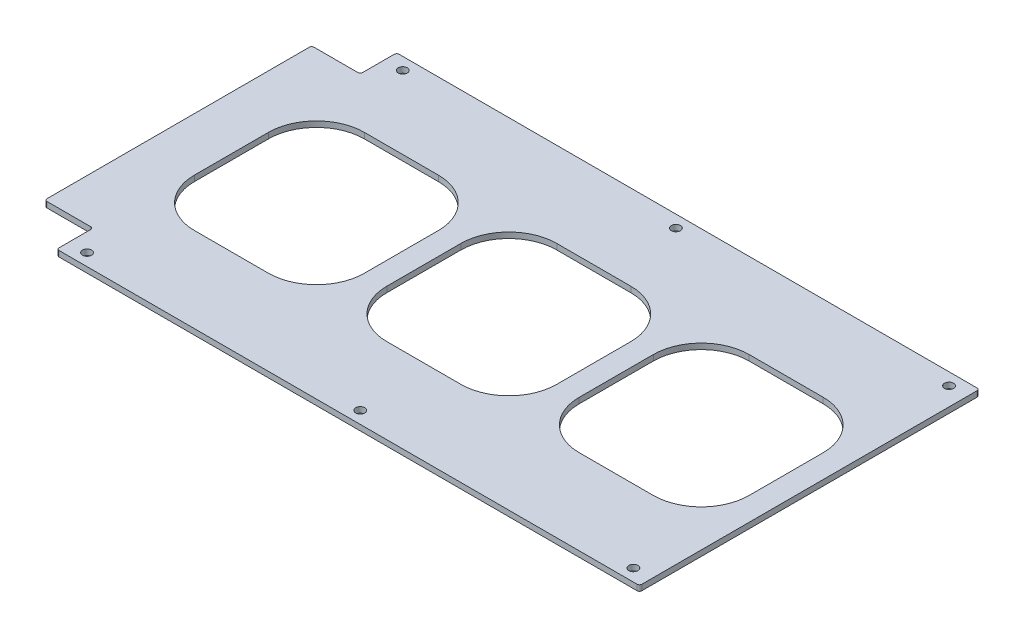
from build123d import *

# Parameters (mm, degrees)
SKETCH1_R           = 2.38125
BOSS_EXTRUDE1_DEPTH = 2.9718


with BuildPart() as part:
    # Sketch1 → Boss-Extrude1 (new body)
    with BuildSketch(Plane(origin=(0, 0, 0), x_dir=(1, 0, 0), z_dir=(0, 1, 0))):
        with BuildLine():
            Line((-150.495, 88.9), (151.765, 88.9))
            ThreePointArc((151.765, 88.9), (152.663025612, 88.528025612), (153.035, 87.63))
            Line((153.035, 87.63), (153.035, -87.63))
            ThreePointArc((153.035, -87.63), (152.663025612, -88.528025612), (151.765, -88.9))
            Line((151.765, -88.9), (-150.495, -88.9))
            ThreePointArc((-150.495, -88.9), (-151.393025612, -88.528025612), (-151.765, -87.63))
            Line((-151.765, -87.63), (-151.765, -71.12))
            ThreePointArc((-151.765, -71.12), (-152.136974388, -70.221974388), (-153.035, -69.85))
            Line((-153.035, -69.85), (-175.895, -69.85))
            ThreePointArc((-175.895, -69.85), (-176.793025612, -69.478025612), (-177.165, -68.58))
            Line((-177.165, -68.58), (-177.165, 68.58))
            ThreePointArc((-177.165, 68.58), (-176.793025612, 69.478025612), (-175.895, 69.85))
            Line((-175.895, 69.85), (-153.035, 69.85))
            ThreePointArc((-153.035, 69.85), (-152.136974388, 70.221974388), (-151.765, 71.12))
            Line((-151.765, 71.12), (-151.765, 87.63))
            ThreePointArc((-151.765, 87.63), (-151.393025612, 88.528025612), (-150.495, 88.9))
        make_face()
        with Locations((-142.24, 82.55)):
            Circle(SKETCH1_R, mode=Mode.SUBTRACT)
        with Locations((143.51, 82.55)):
            Circle(SKETCH1_R, mode=Mode.SUBTRACT)
        with Locations((0.635, 82.55)):
            Circle(SKETCH1_R, mode=Mode.SUBTRACT)
        with Locations((-142.24, -82.55)):
            Circle(SKETCH1_R, mode=Mode.SUBTRACT)
        with Locations((0.635, -82.55)):
            Circle(SKETCH1_R, mode=Mode.SUBTRACT)
        with Locations((143.51, -82.55)):
            Circle(SKETCH1_R, mode=Mode.SUBTRACT)
        with BuildLine():
            Line((-124.2065, 44.45), (-85.4715, 44.45))
            ThreePointArc((-85.4715, 44.45), (-67.735494161, 37.103505839), (-60.389, 19.3675))
            Line((-60.389, 19.3675), (-60.389, -19.3675))
            ThreePointArc((-60.389, -19.3675), (-67.735494161, -37.103505839), (-85.4715, -44.45))
            Line((-85.4715, -44.45), (-124.2065, -44.45))
            ThreePointArc((-124.2065, -44.45), (-141.942505839, -37.103505839), (-149.289, -19.3675))
            Line((-149.289, -19.3675), (-149.289, 19.3675))
            ThreePointArc((-149.289, 19.3675), (-141.942505839, 37.103505839), (-124.2065, 44.45))
        make_face(mode=Mode.SUBTRACT)
        with BuildLine():
            Line((-23.5715, 44.45), (15.1635, 44.45))
            ThreePointArc((15.1635, 44.45), (32.899505839, 37.103505839), (40.246, 19.3675))
            Line((40.246, 19.3675), (40.246, -19.3675))
            ThreePointArc((40.246, -19.3675), (32.899505839, -37.103505839), (15.1635, -44.45))
            Line((15.1635, -44.45), (-23.5715, -44.45))
            ThreePointArc((-23.5715, -44.45), (-41.307505839, -37.103505839), (-48.654, -19.3675))
            Line((-48.654, -19.3675), (-48.654, 19.3675))
            ThreePointArc((-48.654, 19.3675), (-41.307505839, 37.103505839), (-23.5715, 44.45))
        make_face(mode=Mode.SUBTRACT)
        with BuildLine():
            Line((77.0635, 44.45), (115.7985, 44.45))
            ThreePointArc((115.7985, 44.45), (133.534505839, 37.103505839), (140.881, 19.3675))
            Line((140.881, 19.3675), (140.881, -19.3675))
            ThreePointArc((140.881, -19.3675), (133.534505839, -37.103505839), (115.7985, -44.45))
            Line((115.7985, -44.45), (77.0635, -44.45))
            ThreePointArc((77.0635, -44.45), (59.327494161, -37.103505839), (51.981, -19.3675))
            Line((51.981, -19.3675), (51.981, 19.3675))
            ThreePointArc((51.981, 19.3675), (59.327494161, 37.103505839), (77.0635, 44.45))
        make_face(mode=Mode.SUBTRACT)
    extrude(amount=BOSS_EXTRUDE1_DEPTH)


solid = part.part
